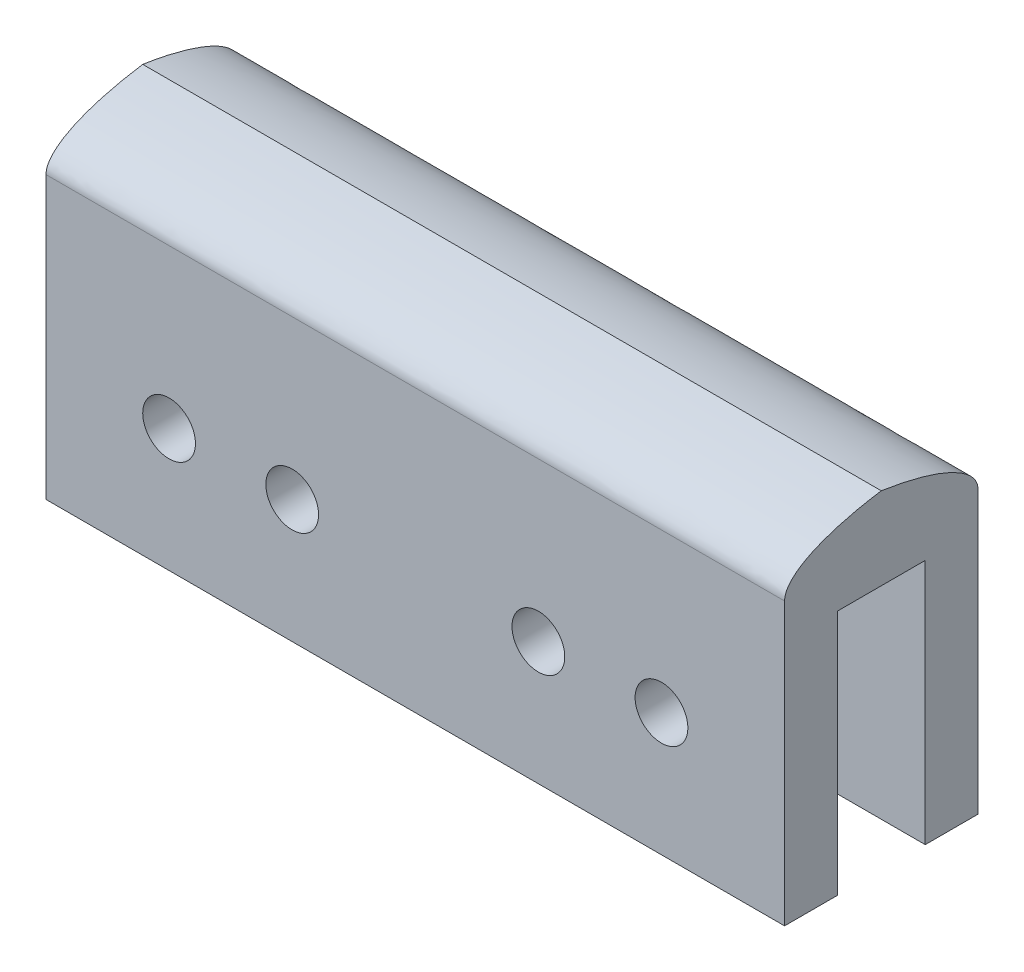
from build123d import *

# Parameters (mm, degrees)
SKETCH1_W             = 42
SKETCH1_H             = 3
BOSS_EXTRUDE1_DEPTH   = 14
BOSS_EXTRUDE1_2_DEPTH = 14
SKETCH2_R             = 1.5
CUT_EXTRUDE1_DEPTH    = 14
SKETCH3_W             = 42
SKETCH3_H             = 11
BOSS_EXTRUDE2_DEPTH   = 5
FILLET1_SIZE          = 3
FILLET1_SIZE_2        = 10


with BuildPart() as part:
    # Sketch1 → Boss-Extrude1 (new body)
    with BuildSketch(Plane(origin=(0, 0, 0), x_dir=(1, 0, 0), z_dir=(0, 1, 0))):
        with Locations((21, -1.5)):
            Rectangle(SKETCH1_W, SKETCH1_H)
    extrude(amount=BOSS_EXTRUDE1_DEPTH)


with BuildPart() as body_2:
    # Sketch1 → Boss-Extrude1 2 (new body)
    with BuildSketch(Plane(origin=(0, 0, 0), x_dir=(1, 0, 0), z_dir=(0, 1, 0))):
        with Locations((21, -9.5)):
            Rectangle(SKETCH1_W, SKETCH1_H)
    extrude(amount=BOSS_EXTRUDE1_2_DEPTH)


with BuildPart() as cut_extrude1_tool:
    # Sketch2 → Cut-Extrude1 (new body)
    with BuildSketch(Plane(origin=(0, 0, 0), x_dir=(-1, 0, 0), z_dir=(0, 0, -1))):
        with BuildLine():
            Line((-36.5, 7), (-35, 7))
            Line((-35, 7), (-33.5, 7))
            ThreePointArc((-33.5, 7), (-35, 8.5), (-36.5, 7))
        make_face()
        with BuildLine():
            Line((-33.5, 7), (-35, 7))
            Line((-35, 7), (-36.5, 7))
            ThreePointArc((-36.5, 7), (-35, 5.5), (-33.5, 7))
        make_face()
        with BuildLine():
            ThreePointArc((-26.5, 7), (-28, 8.5), (-29.5, 7))
            Line((-29.5, 7), (-28, 7))
            Line((-28, 7), (-26.5, 7))
        make_face()
        with BuildLine():
            Line((-28, 7), (-29.5, 7))
            ThreePointArc((-29.5, 7), (-28, 5.5), (-26.5, 7))
            Line((-26.5, 7), (-28, 7))
        make_face()
        with BuildLine():
            ThreePointArc((-5.5, 7), (-7, 8.5), (-8.5, 7))
            Line((-8.5, 7), (-7, 7))
            Line((-7, 7), (-5.5, 7))
        make_face()
        with BuildLine():
            Line((-7, 7), (-8.5, 7))
            ThreePointArc((-8.5, 7), (-7, 5.5), (-5.5, 7))
            Line((-5.5, 7), (-7, 7))
        make_face()
        with Locations((-14, 7)):
            Circle(SKETCH2_R)
    extrude(amount=-CUT_EXTRUDE1_DEPTH)


with BuildPart() as part_1:
    add(part.part)

    # Cut-Extrude1: cut by cut_extrude1_tool
    add(cut_extrude1_tool.part, mode=Mode.SUBTRACT)



with BuildPart() as body_2_1:
    add(body_2.part)

    # Cut-Extrude1: cut by cut_extrude1_tool
    add(cut_extrude1_tool.part, mode=Mode.SUBTRACT)


with BuildPart() as part_2:
    add(part_1.part)

    add(body_2_1.part)  # Boss-Extrude2 merges body 2
    # Sketch3 → Boss-Extrude2 (add)
    with BuildSketch(Plane(origin=(0, 14, 0), x_dir=(1, 0, 0), z_dir=(0, 1, 0))):
        with Locations((21, -5.5)):
            Rectangle(SKETCH3_W, SKETCH3_H)
    extrude(amount=BOSS_EXTRUDE2_DEPTH)

    # Fillet1
    # an asymmetric fillet: 10, 3 mm, written as the material it takes off along each edge
    with BuildSketch(Plane(origin=(67, 19, 0), x_dir=(0, -1, 0), z_dir=(-1, 0, 0))) as fillet1_piece_1:
        with BuildLine():
            Bezier((FILLET1_SIZE, 0), (0, 0), (0, FILLET1_SIZE_2), weights=[1, 0.707106781, 1])
            Line((0, FILLET1_SIZE_2), (0, 0))
            Line((0, 0), (FILLET1_SIZE, 0))
        make_face()
    extrude(amount=92, mode=Mode.SUBTRACT)
    with BuildSketch(Plane(origin=(-25, 19, 11), x_dir=(0, 0, -1), z_dir=(1, 0, 0))) as fillet1_piece_2:
        with BuildLine():
            Bezier((FILLET1_SIZE_2, 0), (0, 0), (0, -FILLET1_SIZE), weights=[1, 0.707106781, 1])
            Line((0, -FILLET1_SIZE), (0, 0))
            Line((0, 0), (FILLET1_SIZE_2, 0))
        make_face()
    extrude(amount=92, mode=Mode.SUBTRACT)


solid = part_2.part
